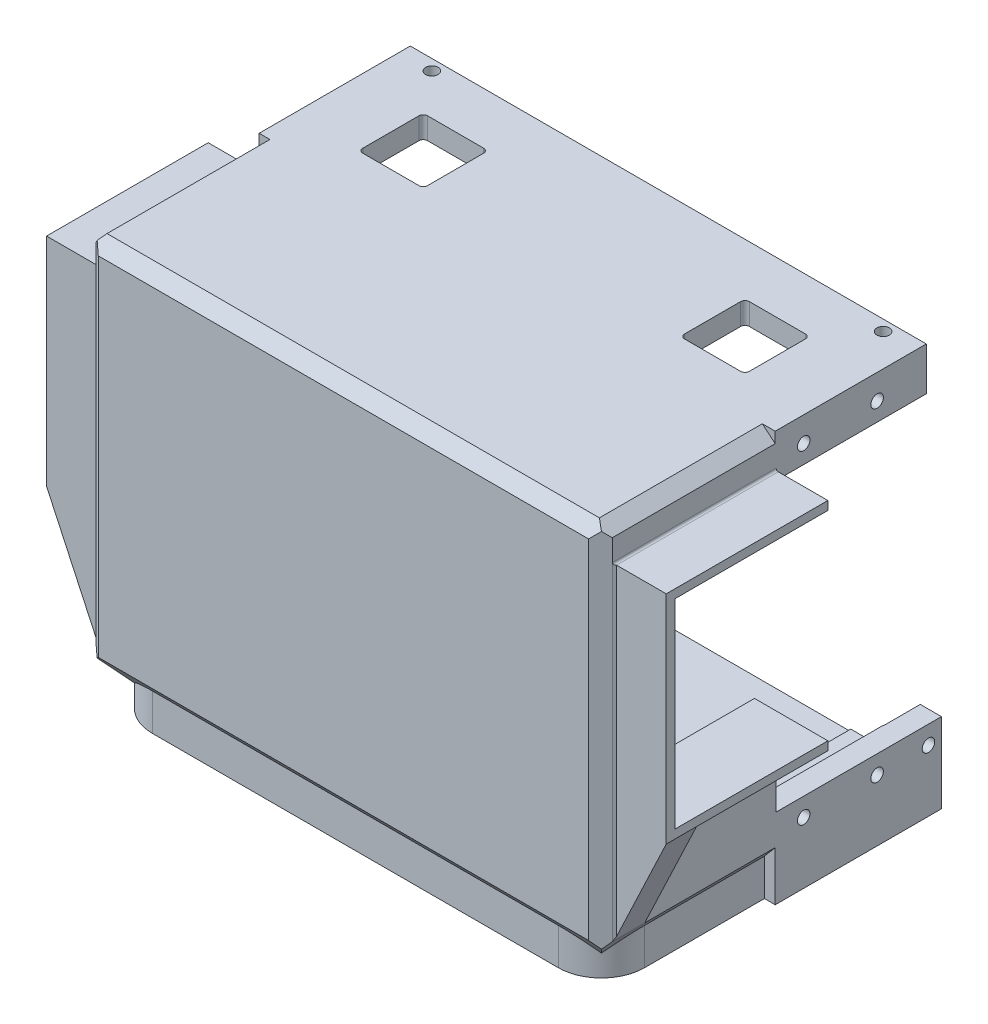
from build123d import *
from OCP.BRepFilletAPI import BRepFilletAPI_MakeChamfer

# Parameters (mm, degrees)
SKETCH1_W                                  = 119.52
SKETCH1_H                                  = 86.5
BOSS_EXTRUDE1_DEPTH                        = 70.24
SHELL1_T                                   = -5
CHAMFER1_SIZE                              = 2.5
CHAMFER1_SIZE2                             = 2.979383981
CHAMFER2_SIZE                              = 2.5
CHAMFER2_SIZE2                             = 2.979383981
CHAMFER3_SIZE                              = 2.5
CHAMFER3_SIZE2                             = 2.979383981
CUT_EXTRUDE1_START                         = -119.52
CUT_EXTRUDE1_OUTLINE_W                     = 67.74
CUT_EXTRUDE1_OUTLINE_H                     = 66.5
CUT_EXTRUDE1_DEPTH                         = 119.52
SKETCH4_W                                  = 109.52
SKETCH4_H                                  = 5
BOSS_EXTRUDE2_DEPTH                        = 5
CUT_EXTRUDE2_REACH                         = 128.44
SKETCH5_R                                  = 1.45
BOSS_EXTRUDE3_DEPTH                        = 8.5
BOSS_EXTRUDE4_DEPTH                        = 5
BOSS_EXTRUDE6_DEPTH                        = 35
BOSS_EXTRUDE7_DEPTH                        = 8.5
BOSS_EXTRUDE8_DEPTH                        = 35
BOSS_EXTRUDE9_DEPTH                        = 38.5
SKETCH16_W                                 = 5
SKETCH16_H                                 = 27.5
BOSS_EXTRUDE10_DEPTH                       = 3
MIRROR7_COPY_1_SKETCH_W                    = 5
MIRROR7_COPY_1_SKETCH_H                    = 27.5
MIRROR7_COPY_1_DEPTH                       = 3
SKETCH15_R                                 = 1.45
CUT_EXTRUDE5_DEPTH                         = 8
MIRROR8_AT_THE_SECOND_PLANE_COPY_1_SKETC_R = 1.45
MIRROR8_AT_THE_SECOND_PLANE_COPY_1_DEPTH   = 8
SKETCH17_R                                 = 1.45
CUT_EXTRUDE6_DEPTH                         = 8
SKETCH18_R                                 = 1.45
CUT_EXTRUDE7_DEPTH                         = 8
SKETCH19_W                                 = 15
SKETCH19_H                                 = 15
CUT_EXTRUDE8_DEPTH                         = 5
FILLET2_R                                  = 1
FILLET2_OF_MIRROR10_R                      = 1
BOSS_EXTRUDE11_DEPTH                       = 8.5
FILLET3_R                                  = 10
SKETCH21_W                                 = 119.52
SKETCH21_H                                 = 66.5
BOSS_EXTRUDE12_DEPTH                       = 2.5
BOSS_EXTRUDE13_DEPTH                       = 12
SKETCH23_W                                 = 5
SKETCH23_H                                 = 20.3
BOSS_EXTRUDE14_DEPTH                       = 35.44
CUT_EXTRUDE9_DEPTH                         = 20
CUT_EXTRUDE9_DEPTH_BACK                    = 10
SKETCH24_W                                 = 22.94
SKETCH24_H                                 = 15.3
BOSS_EXTRUDE15_DEPTH                       = 7
CHAMFER9_SIZE                              = 0.5
BOSS_EXTRUDE16_DEPTH                       = 7
CHAMFER10_SIZE                             = 0.5
FILLET4_R                                  = 0.5
FILLET5_R                                  = 0.5


# Read off the part's stored shape, not the designer's step: Cut-Extrude1
with BuildPart() as part:
    # Sketch1 → Boss-Extrude1 (new body)
    with BuildSketch(Plane.XY):
        Rectangle(SKETCH1_W, SKETCH1_H)
    extrude(amount=BOSS_EXTRUDE1_DEPTH)

    # Shell1
    shell1_openings = [part.faces().sort_by_distance(p)[0] for p in [
        (0, 0, 0),
    ]]
    offset(amount=SHELL1_T, openings=shell1_openings, kind=Kind.INTERSECTION)

    # Chamfer1: one chamfer whose edges measure the first distance from different faces: ONE call of the kernel's chamfer builder (chamfer() names one face for all edges)
    chamfer1_edges_1 = [part.edges().sort_by_distance(p)[0] for p in [
        (59.76, 0, 70.24),
    ]]
    chamfer1_side_1 = [part.faces().sort_by_distance(p)[0] for p in [
        (59.76, 0, 35.12),
    ]]
    chamfer1_edges_2 = [part.edges().sort_by_distance(p)[0] for p in [
        (0, 43.25, 70.24),
    ]]
    chamfer1_side_2 = [part.faces().sort_by_distance(p)[0] for p in [
        (0, 43.25, 35.12),
    ]]
    chamfer1_edges_3 = [part.edges().sort_by_distance(p)[0] for p in [
        (-59.76, 0, 70.24),
    ]]
    chamfer1_side_3 = [part.faces().sort_by_distance(p)[0] for p in [
        (-59.76, 0, 35.12),
    ]]
    chamfer1_edges_4 = [part.edges().sort_by_distance(p)[0] for p in [
        (0, -43.25, 70.24),
    ]]
    chamfer1_side_4 = [part.faces().sort_by_distance(p)[0] for p in [
        (0, -43.25, 35.12),
    ]]
    chamfer1 = BRepFilletAPI_MakeChamfer(part.part.solid().wrapped)
    for e in chamfer1_edges_1:
        chamfer1.Add(CHAMFER1_SIZE, CHAMFER1_SIZE2, e.wrapped, chamfer1_side_1[0].wrapped)  # the first distance lies on this face
    for e in chamfer1_edges_2:
        chamfer1.Add(CHAMFER1_SIZE, CHAMFER1_SIZE2, e.wrapped, chamfer1_side_2[0].wrapped)  # the first distance lies on this face
    for e in chamfer1_edges_3:
        chamfer1.Add(CHAMFER1_SIZE, CHAMFER1_SIZE2, e.wrapped, chamfer1_side_3[0].wrapped)  # the first distance lies on this face
    for e in chamfer1_edges_4:
        chamfer1.Add(CHAMFER1_SIZE, CHAMFER1_SIZE2, e.wrapped, chamfer1_side_4[0].wrapped)  # the first distance lies on this face
    add(Compound.cast(chamfer1.Shape()), mode=Mode.REPLACE)

    # Chamfer2
    chamfer2_edges = [part.edges().sort_by_distance(p)[0] for p in [
        (-59.76, 43.25, 33.87),
    ]]
    chamfer2_side = [part.faces().sort_by_distance(p)[0] for p in [
        (0, 43.25, 33.87),
    ]]
    chamfer(chamfer2_edges, length=CHAMFER2_SIZE, length2=CHAMFER2_SIZE2, reference=chamfer2_side[0])

    # Chamfer3: one chamfer whose edges measure the first distance from different faces: ONE call of the kernel's chamfer builder (chamfer() names one face for all edges)
    chamfer3_edges_1 = [part.edges().sort_by_distance(p)[0] for p in [
        (59.76, -43.25, 33.87),
    ]]
    chamfer3_side_1 = [part.faces().sort_by_distance(p)[0] for p in [
        (0, -43.25, 33.87),
    ]]
    chamfer3_edges_2 = [part.edges().sort_by_distance(p)[0] for p in [
        (-59.76, -43.25, 33.87),
    ]]
    chamfer3_side_2 = [part.faces().sort_by_distance(p)[0] for p in [
        (-59.76, -1.489691991, 33.87),
    ]]
    chamfer3_edges_3 = [part.edges().sort_by_distance(p)[0] for p in [
        (59.76, 43.25, 33.87),
    ]]
    chamfer3_side_3 = [part.faces().sort_by_distance(p)[0] for p in [
        (59.76, 0, 33.87),
    ]]
    chamfer3 = BRepFilletAPI_MakeChamfer(part.part.solid().wrapped)
    for e in chamfer3_edges_1:
        chamfer3.Add(CHAMFER3_SIZE, CHAMFER3_SIZE2, e.wrapped, chamfer3_side_1[0].wrapped)  # the first distance lies on this face
    for e in chamfer3_edges_2:
        chamfer3.Add(CHAMFER3_SIZE, CHAMFER3_SIZE2, e.wrapped, chamfer3_side_2[0].wrapped)  # the first distance lies on this face
    for e in chamfer3_edges_3:
        chamfer3.Add(CHAMFER3_SIZE, CHAMFER3_SIZE2, e.wrapped, chamfer3_side_3[0].wrapped)  # the first distance lies on this face
    add(Compound.cast(chamfer3.Shape()), mode=Mode.REPLACE)

    # Cut-Extrude1 outline → Cut-Extrude1 (cut)
    with BuildSketch(Plane(origin=(59.76, 0, 0), x_dir=(0, 0, -1), z_dir=(1, 0, 0)).offset(CUT_EXTRUDE1_START)):
        with Locations((-33.87, 0)):
            Rectangle(CUT_EXTRUDE1_OUTLINE_W, CUT_EXTRUDE1_OUTLINE_H)
    extrude(amount=CUT_EXTRUDE1_DEPTH, mode=Mode.SUBTRACT)

    # Sketch4 → Boss-Extrude2 (add)
    with BuildSketch(Plane(origin=(0, 0, 0), x_dir=(-1, 0, 0), z_dir=(0, 0, -1))):
        with Locations((0, 40.75)):
            Rectangle(SKETCH4_W, SKETCH4_H)
    extrude(amount=BOSS_EXTRUDE2_DEPTH)

    # Sketch5 → Cut-Extrude2 (cut, up to next)
    with BuildSketch(Plane(origin=(0, 43.25, 0), x_dir=(1, 0, 0), z_dir=(0, 1, 0)), mode=Mode.PRIVATE) as cut_extrude2_sk1:
        with Locations(Location((-52.26, 2.5, 0), (0, 0, 270))):
            Circle(SKETCH5_R)
    cut_extrude2_tool1 = extrude(cut_extrude2_sk1.sketch, amount=-CUT_EXTRUDE2_REACH, mode=Mode.PRIVATE) & part.part
    # Sketch5 → Cut-Extrude2 (cut, up to next)
    with BuildSketch(Plane(origin=(0, 43.25, 0), x_dir=(1, 0, 0), z_dir=(0, 1, 0)), mode=Mode.PRIVATE) as cut_extrude2_sk2:
        with Locations(Location((52.26, 2.5, 0), (0, 0, 270))):
            Circle(SKETCH5_R)
    cut_extrude2_tool2 = extrude(cut_extrude2_sk2.sketch, amount=-CUT_EXTRUDE2_REACH, mode=Mode.PRIVATE) & part.part
    add(cut_extrude2_tool1.solids().sort_by_distance((-52.26, 43.25, -2.5))[0], mode=Mode.SUBTRACT)
    add(cut_extrude2_tool2.solids().sort_by_distance((52.26, 43.25, -2.5))[0], mode=Mode.SUBTRACT)

    # Sketch6 → Boss-Extrude3 (add)
    with BuildSketch(Plane(origin=(0, 0, 0), x_dir=(-1, 0, 0), z_dir=(0, 0, -1))):
        Polygon((-59.76, -33.25), (-54.86, -33.25), (-54.86, -43.25), (-57.26, -43.25), (-59.76, -40.270616019), align=None)
    extrude(amount=BOSS_EXTRUDE3_DEPTH)

    # Sketch8 → Boss-Extrude4 (add)
    with BuildSketch(Plane(origin=(0, 0, 0), x_dir=(-1, 0, 0), z_dir=(0, 0, -1))):
        Polygon((57.26, 43.25), (54.76, 43.25), (54.76, 38.25), (54.76, 33.25), (59.76, 33.25), (59.76, 40.270616019), align=None)
        Polygon((-54.76, 33.25), (-54.76, 38.25), (-54.76, 43.25), (-56.780616019, 43.25), (-59.76, 40.75), (-59.76, 33.25), align=None)
    extrude(amount=BOSS_EXTRUDE4_DEPTH)

    # Sketch10 → Boss-Extrude6 (add)
    with BuildSketch(Plane(origin=(0, 0, -5), x_dir=(-1, 0, 0), z_dir=(0, 0, -1))):
        Polygon((-59.76, 40.75), (-59.76, 43.25), (-56.780616019, 43.25), align=None)
    extrude(amount=-BOSS_EXTRUDE6_DEPTH)

    # Sketch11 → Boss-Extrude7 (add)
    with BuildSketch(Plane(origin=(0, 0, 0), x_dir=(-1, 0, 0), z_dir=(0, 0, -1))):
        Polygon((59.76, -33.25), (54.86, -33.25), (54.86, -43.25), (56.780616019, -43.25), (59.76, -40.75), align=None)
    extrude(amount=BOSS_EXTRUDE7_DEPTH)

    # Sketch13 → Boss-Extrude8 (add)
    with BuildSketch(Plane(origin=(0, 0, -5), x_dir=(-1, 0, 0), z_dir=(0, 0, -1))):
        Polygon((57.26, 43.25), (59.76, 43.25), (59.76, 40.270616019), align=None)
    extrude(amount=-BOSS_EXTRUDE8_DEPTH)

    # Sketch14 → Boss-Extrude9 (add)
    with BuildSketch(Plane(origin=(0, 0, -8.5), x_dir=(-1, 0, 0), z_dir=(0, 0, -1))):
        Polygon((-59.76, -40.270616019), (-59.76, -43.25), (-57.26, -43.25), align=None)
        Polygon((59.76, -40.75), (59.76, -43.25), (56.780616019, -43.25), align=None)
    extrude(amount=-BOSS_EXTRUDE9_DEPTH)

    # Sketch16 → Boss-Extrude10 (add)
    with BuildSketch(Plane.XZ.offset(-38.25)):
        with Locations((52.26, 16.25)):
            Rectangle(SKETCH16_W, SKETCH16_H)
    boss_extrude10 = extrude(amount=BOSS_EXTRUDE10_DEPTH)

    # Mirror6: Boss-Extrude10 across plane
    add(boss_extrude10.mirror(Plane(origin=(0, 0, 0), x_dir=(0, 0, 1), z_dir=(1, 0, 0))))

    # Mirror7: Boss-Extrude10 across plane
    add(boss_extrude10.mirror(Plane.ZX))

    # Mirror7 copy 1 sketch → Mirror7 copy 1 (add)
    with BuildSketch(Plane(origin=(0, -38.25, 0), x_dir=(-1, 0, 0), z_dir=(0, 1, 0))):
        with Locations((52.26, 16.25)):
            Rectangle(MIRROR7_COPY_1_SKETCH_W, MIRROR7_COPY_1_SKETCH_H)
    extrude(amount=MIRROR7_COPY_1_DEPTH)

    # Sketch15 → Cut-Extrude5 (cut)
    with BuildSketch(Plane(origin=(59.76, 0, 0), x_dir=(0, 0, -1), z_dir=(1, 0, 0))):
        with Locations((-6.4, 37.5)):
            Circle(SKETCH15_R)
        with Locations((-23.4, 37.5)):
            Circle(SKETCH15_R)
    cut_extrude5 = extrude(amount=-CUT_EXTRUDE5_DEPTH, mode=Mode.SUBTRACT)

    # Mirror8: Cut-Extrude5 across plane
    add(cut_extrude5.mirror(Plane.ZX), mode=Mode.SUBTRACT)

    # Mirror8 at the second plane: Cut-Extrude5 across plane
    add(cut_extrude5.mirror(Plane(origin=(0, 0, 0), x_dir=(0, 0, 1), z_dir=(1, 0, 0))), mode=Mode.SUBTRACT)

    # Mirror8 at the second plane copy 1 sketc → Mirror8 at the second plane copy 1 (cut)
    with BuildSketch(Plane(origin=(-59.76, 0, 0), x_dir=(0, 0, -1), z_dir=(-1, 0, 0))):
        with Locations((-6.4, 37.5)):
            Circle(MIRROR8_AT_THE_SECOND_PLANE_COPY_1_SKETC_R)
        with Locations((-23.4, 37.5)):
            Circle(MIRROR8_AT_THE_SECOND_PLANE_COPY_1_SKETC_R)
    extrude(amount=-MIRROR8_AT_THE_SECOND_PLANE_COPY_1_DEPTH, mode=Mode.SUBTRACT)

    # Sketch17 → Cut-Extrude6 (cut)
    with BuildSketch(Plane(origin=(59.76, 0, 0), x_dir=(0, 0, -1), z_dir=(1, 0, 0))):
        with Locations((5.5, -37.5)):
            Circle(SKETCH17_R)
    extrude(amount=-CUT_EXTRUDE6_DEPTH, mode=Mode.SUBTRACT)

    # Sketch18 → Cut-Extrude7 (cut)
    with BuildSketch(Plane(origin=(-54.86, 0, 0), x_dir=(0, 0, -1), z_dir=(1, 0, 0))):
        with Locations((5.5, -37.5)):
            Circle(SKETCH18_R)
    extrude(amount=-CUT_EXTRUDE7_DEPTH, mode=Mode.SUBTRACT)

    # Sketch19 → Cut-Extrude8 (cut)
    with BuildSketch(Plane(origin=(0, 43.25, 0), x_dir=(1, 0, 0), z_dir=(0, 1, 0))):
        with Locations((-37.26, -14.5)):
            Rectangle(SKETCH19_W, SKETCH19_H)
    cut_extrude8 = extrude(amount=-CUT_EXTRUDE8_DEPTH, mode=Mode.SUBTRACT)

    # Fillet2
    fillet2_edges = [part.edges().sort_by_distance(p)[0] for p in [
        (-44.76, 40.75, 22),
        (-44.76, 40.75, 7),
        (-29.76, 40.75, 7),
        (-29.76, 40.75, 22),
    ]]
    fillet(fillet2_edges, radius=FILLET2_R)

    # Mirror10: Cut-Extrude8 across plane
    add(cut_extrude8.mirror(Plane(origin=(0, 0, 0), x_dir=(0, 0, 1), z_dir=(1, 0, 0))), mode=Mode.SUBTRACT)

    # Fillet2 of Mirror10
    fillet2_of_mirror10_edges = [part.edges().sort_by_distance(p)[0] for p in [
        (44.76, 40.75, 22),
        (44.76, 40.75, 7),
        (29.76, 40.75, 7),
        (29.76, 40.75, 22),
    ]]
    fillet(fillet2_of_mirror10_edges, radius=FILLET2_OF_MIRROR10_R)

    # Sketch20 → Boss-Extrude11 (add)
    with BuildSketch(Plane.XZ.offset(43.25)):
        Polygon((-56.780616019, 67.74), (57.26, 67.74), (57.26, 30), (59.76, 30), (59.76, 0), (59.76, -8.5), (54.86, -8.5), (54.86, 0), (-54.86, 0), (-54.86, -8.5), (-59.76, -8.5), (-59.76, 0), (-59.76, 30), (-56.780616019, 30), align=None)
    extrude(amount=BOSS_EXTRUDE11_DEPTH)

    # Fillet3
    fillet3_edges = [part.edges().sort_by_distance(p)[0] for p in [
        (-56.780616019, -47.5, 67.74),
        (57.26, -47.5, 67.74),
    ]]
    fillet(fillet3_edges, radius=FILLET3_R)

    # Sketch21 → Boss-Extrude12 (add)
    with BuildSketch(Plane(origin=(0, 0, 67.74), x_dir=(-1, 0, 0), z_dir=(0, 0, -1))):
        Rectangle(SKETCH21_W, SKETCH21_H)
    extrude(amount=BOSS_EXTRUDE12_DEPTH)

    # Sketch22 → Boss-Extrude13 (add)
    with BuildSketch(Plane(origin=(59.76, 0, 0), x_dir=(0, 0, -1), z_dir=(1, 0, 0))):
        Polygon((-65.24, 33.25), (-29.8, 33.25), (-29.8, 35.25), (-67.24, 35.25), (-67.24, -14.95), (-29.8, -14.95), (-29.8, -12.95), (-65.24, -12.95), align=None)
    boss_extrude13 = extrude(amount=BOSS_EXTRUDE13_DEPTH)

    # Sketch23 → Boss-Extrude14 (add)
    with BuildSketch(Plane(origin=(0, 0, 65.24), x_dir=(-1, 0, 0), z_dir=(0, 0, -1))):
        with Locations((-57.26, -23.1)):
            Rectangle(SKETCH23_W, SKETCH23_H)
    boss_extrude14 = extrude(amount=BOSS_EXTRUDE14_DEPTH)

    # Mirror12: Boss-Extrude13, Boss-Extrude14 across plane
    add(boss_extrude13.mirror(Plane(origin=(0, 0, 0), x_dir=(0, 0, 1), z_dir=(1, 0, 0))))
    add(boss_extrude14.mirror(Plane(origin=(0, 0, 0), x_dir=(0, 0, 1), z_dir=(1, 0, 0))))

    # Sketch24 → Cut-Extrude9 (cut, two sides: drawn at the far end of the back side and taken through both)
    with BuildSketch(Plane.ZY.offset(59.76).offset(-CUT_EXTRUDE9_DEPTH_BACK)):
        with Locations((48.77, -20.6)):
            Rectangle(SKETCH24_W, SKETCH24_H)
    extrude(amount=CUT_EXTRUDE9_DEPTH + CUT_EXTRUDE9_DEPTH_BACK, mode=Mode.SUBTRACT)

    # Sketch25 → Boss-Extrude15 (add)
    with BuildSketch(Plane.XY.offset(67.24)):
        Polygon((-71.76, -14.95), (-59.76, -40.75), (-59.76, -14.95), align=None)
    extrude(amount=-BOSS_EXTRUDE15_DEPTH)

    # Chamfer9
    chamfer9_edges = [part.edges().sort_by_distance(p)[0] for p in [
        (-59.76, -2.75, 67.24),
    ]]
    chamfer(chamfer9_edges, length=CHAMFER9_SIZE - 0.0001)  # a hair under: the kernel refuses the full size

    # Sketch29 → Boss-Extrude16 (add)
    with BuildSketch(Plane.XY.offset(67.24)):
        Polygon((71.76, -14.95), (59.76, -14.95), (59.76, -40.270616019), align=None)
    extrude(amount=-BOSS_EXTRUDE16_DEPTH)

    # Chamfer10
    chamfer10_edges = [part.edges().sort_by_distance(p)[0] for p in [
        (59.76, -2.510308009, 67.24),
    ]]
    chamfer(chamfer10_edges, length=CHAMFER10_SIZE - 0.0001)  # a hair under: the kernel refuses the full size

    # Fillet4
    fillet4_edges = [part.edges().sort_by_distance(p)[0] for p in [
        (-59.76, 35.25, 48.76995),
    ]]
    fillet(fillet4_edges, radius=FILLET4_R - 0.0001)  # a hair under: the kernel refuses the full size

    # Fillet5
    fillet5_edges = [part.edges().sort_by_distance(p)[0] for p in [
        (59.76, 35.25, 48.76995),
    ]]
    fillet(fillet5_edges, radius=FILLET5_R - 0.0001)  # a hair under: the kernel refuses the full size


solid = part.part
